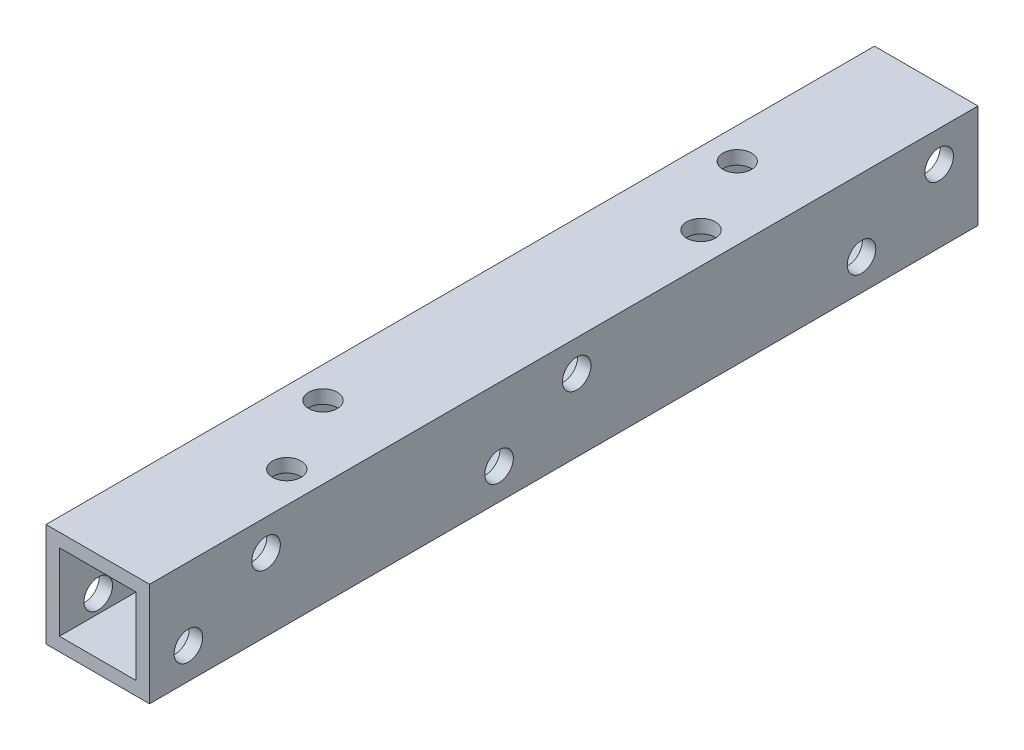
from build123d import *

# Parameters (mm, degrees)
SKETCH1_W           = 12.7
SKETCH1_H           = 12.7
SKETCH1_W_2         = 9.398
SKETCH1_H_2         = 9.398
BOSS_EXTRUDE1_DEPTH = 101.6
SKETCH2_R           = 1.75
CUT_EXTRUDE1_DEPTH  = 22.2885
SKETCH3_R           = 1.75
CUT_EXTRUDE2_DEPTH  = 22.098


with BuildPart() as part:
    # Sketch1 → Boss-Extrude1 (new body)
    with BuildSketch(Plane(origin=(0, 0, 0), x_dir=(0, 1, 0), z_dir=(0, 0, 1))):
        Rectangle(SKETCH1_W, SKETCH1_H)
        Rectangle(SKETCH1_W_2, SKETCH1_H_2, mode=Mode.SUBTRACT)
    extrude(amount=BOSS_EXTRUDE1_DEPTH)

    # Sketch2 → Cut-Extrude1 (cut)
    with BuildSketch(Plane(origin=(0, 6.35, 0), x_dir=(-1, 0, 0), z_dir=(0, 1, 0))):
        with Locations((-2.54, 80.9625)):
            Circle(SKETCH2_R)
        with Locations((2.54, 71.4375)):
            Circle(SKETCH2_R)
        with Locations((-2.54, 30.1625)):
            Circle(SKETCH2_R)
        with Locations((2.54, 20.6375)):
            Circle(SKETCH2_R)
    extrude(amount=-CUT_EXTRUDE1_DEPTH, mode=Mode.SUBTRACT)

    # Sketch3 → Cut-Extrude2 (cut)
    with BuildSketch(Plane.YZ.offset(6.35)):
        with Locations((-2.54, 14.2875)):
            Circle(SKETCH3_R)
        with Locations((2.54, 4.7625)):
            Circle(SKETCH3_R)
        with Locations((-2.54, 96.8375)):
            Circle(SKETCH3_R)
        with Locations((2.54, 87.3125)):
            Circle(SKETCH3_R)
        with Locations((-2.54, 58.7375)):
            Circle(SKETCH3_R)
        with Locations((2.54, 49.2125)):
            Circle(SKETCH3_R)
    extrude(amount=-CUT_EXTRUDE2_DEPTH, mode=Mode.SUBTRACT)


solid = part.part
